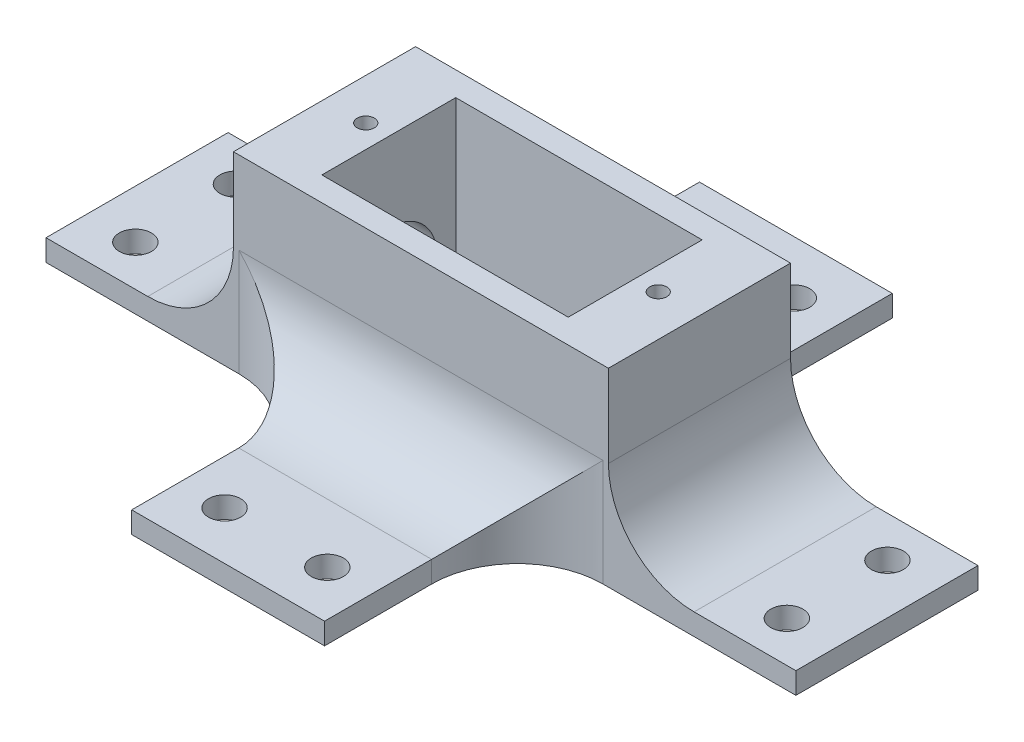
from build123d import *
from build123d.topology import SkipClean

# Parameters (mm, degrees)
SKETCH2_W           = 70
SKETCH2_H           = 17
BOSS_EXTRUDE1_DEPTH = 2
SKETCH3_W           = 35
SKETCH3_H           = 17
BOSS_EXTRUDE2_DEPTH = 15.7
SKETCH4_W           = 23
SKETCH4_H           = 12.5
CUT_EXTRUDE1_DEPTH  = 41.131533736
SKETCH6_R           = 0.8
CUT_EXTRUDE2_DEPTH  = 8
CUT_EXTRUDE3_DEPTH  = 8
SKETCH9_W           = 18
SKETCH9_H           = 2
BOSS_EXTRUDE3_DEPTH = 18
FILLET1_R           = 8
FILLET2_R           = 8
FILLET3_START       = -8.5
FILLET3_DEPTH       = 17
FILLET3_START_2     = -25.5
FILLET3_2_DEPTH     = 8
SKETCH11_R          = 1.5
CUT_EXTRUDE4_DEPTH  = 18


with BuildPart() as part:
    # Sketch2 → Boss-Extrude1 (new body)
    with BuildSketch(Plane(origin=(0, 0, 0), x_dir=(1, 0, 0), z_dir=(0, 1, 0))):
        Rectangle(SKETCH2_W, SKETCH2_H)
    extrude(amount=BOSS_EXTRUDE1_DEPTH)

    # Sketch3 → Boss-Extrude2 (add)
    with BuildSketch(Plane(origin=(0, 2, 0), x_dir=(1, 0, 0), z_dir=(0, 1, 0))):
        Rectangle(SKETCH3_W, SKETCH3_H)
    extrude(amount=BOSS_EXTRUDE2_DEPTH)

    # Sketch4 → Cut-Extrude1 (cut, through all)
    with BuildSketch(Plane(origin=(0, 17.7, 0), x_dir=(1, 0, 0), z_dir=(0, 1, 0))):
        Rectangle(SKETCH4_W, SKETCH4_H)
    extrude(amount=-CUT_EXTRUDE1_DEPTH, mode=Mode.SUBTRACT)

    # Sketch6 → Cut-Extrude2 (cut)
    with BuildSketch(Plane(origin=(0, 17.7, 0), x_dir=(1, 0, 0), z_dir=(0, 1, 0))):
        with Locations(Location((13.65, 0, 0), (0, 0, 270))):
            Circle(SKETCH6_R)
        with Locations(Location((-13.65, 0, 0), (0, 0, 90))):
            Circle(SKETCH6_R)
    extrude(amount=-CUT_EXTRUDE2_DEPTH, mode=Mode.SUBTRACT)

    # Sketch7 → Cut-Extrude3 (cut)
    with BuildSketch(Plane.ZY.offset(17.5)):
        with BuildLine():
            Line((-4.5, 5.8), (-4.5, 3.8))
            Line((-4.5, 3.8), (4.5, 3.8))
            Line((4.5, 3.8), (4.5, 5.8))
            ThreePointArc((4.5, 5.8), (0, 10.3), (-4.5, 5.8))
        make_face()
    extrude(amount=-CUT_EXTRUDE3_DEPTH, mode=Mode.SUBTRACT)

    # Sketch9 → Boss-Extrude3 (add)
    with BuildSketch(Plane.XY.offset(8.5)):
        with Locations((0, 1)):
            Rectangle(SKETCH9_W, SKETCH9_H)
    boss_extrude3 = extrude(amount=BOSS_EXTRUDE3_DEPTH)

    # Mirror1: Boss-Extrude3 across plane
    add(boss_extrude3.mirror(Plane.XY))

    # Fillet1
    fillet1_edges = [part.edges().sort_by_distance(p)[0] for p in [
        (0, 2, 8.5),
    ]]
    fillet(fillet1_edges, radius=FILLET1_R)

    # Fillet2
    fillet2_edges = [part.edges().sort_by_distance(p)[0] for p in [
        (-9, 1, -8.5),
        (-9, 5, 8.5),
        (9, 5, 8.5),
        (9, 1, -8.5),
        (0, 2, -8.5),
        (17.5, 2, 0),
    ]]
    fillet(fillet2_edges, radius=FILLET2_R)

    # Fillet3: read off the stored shape, not the designer's step
    # Fillet3 outline → Fillet3 (add)
    with BuildSketch(Plane.XY.offset(FILLET3_START)):
        with BuildLine():
            ThreePointArc((-17.5, 10.00000495), (-19.843144, 4.343147501), (-25.5, 2))
            Line((-25.5, 2), (-17.5, 2))
            Line((-17.5, 2), (-17.5, 10.00000495))
        make_face()
    extrude(amount=FILLET3_DEPTH)

    # Fillet3 2 outline → Fillet3 2 (cut)
    with SkipClean():  # the faces are left unmerged after this step: merging them gives an invalid solid
        with BuildSketch(Plane.YZ.offset(FILLET3_START_2)):
            with BuildLine():
                ThreePointArc((5.799996271, -4.5), (10.3, -1.865e-06), (5.8, 4.5))
                Line((5.8, 4.5), (3.8, 4.5))
                Line((3.8, 4.5), (3.8, -4.5))
                Line((3.8, -4.5), (5.799996271, -4.5))
            make_face()
        extrude(amount=FILLET3_2_DEPTH, mode=Mode.SUBTRACT)

    # Sketch11 → Cut-Extrude4 (cut)
    with SkipClean():  # the faces are left unmerged after this step: merging them gives an invalid solid
        with BuildSketch(Plane(origin=(0, 2, 0), x_dir=(1, 0, 0), z_dir=(0, 1, 0))):
            with Locations(Location((4.772736854, 21.529356347, 0), (0, 0, 270))):
                Circle(SKETCH11_R)
            with Locations(Location((-4.821076753, 21.529356347, 0), (0, 0, 270))):
                Circle(SKETCH11_R)
            with Locations(Location((4.772736854, -22.011031546, 0), (0, 0, 270))):
                Circle(SKETCH11_R)
            with Locations(Location((-4.821076753, -22.011031546, 0), (0, 0, 270))):
                Circle(SKETCH11_R)
            with Locations(Location((30.348655276, 4.696340636, 0), (0, 0, 270))):
                Circle(SKETCH11_R)
            with Locations(Location((30.348655276, -4.691151825, 0), (0, 0, 270))):
                Circle(SKETCH11_R)
            with Locations(Location((-30.467199024, -4.691151825, 0), (0, 0, 270))):
                Circle(SKETCH11_R)
            with Locations(Location((-30.467199024, 4.696340636, 0), (0, 0, 270))):
                Circle(SKETCH11_R)
        extrude(amount=-CUT_EXTRUDE4_DEPTH, mode=Mode.SUBTRACT)


solid = part.part
